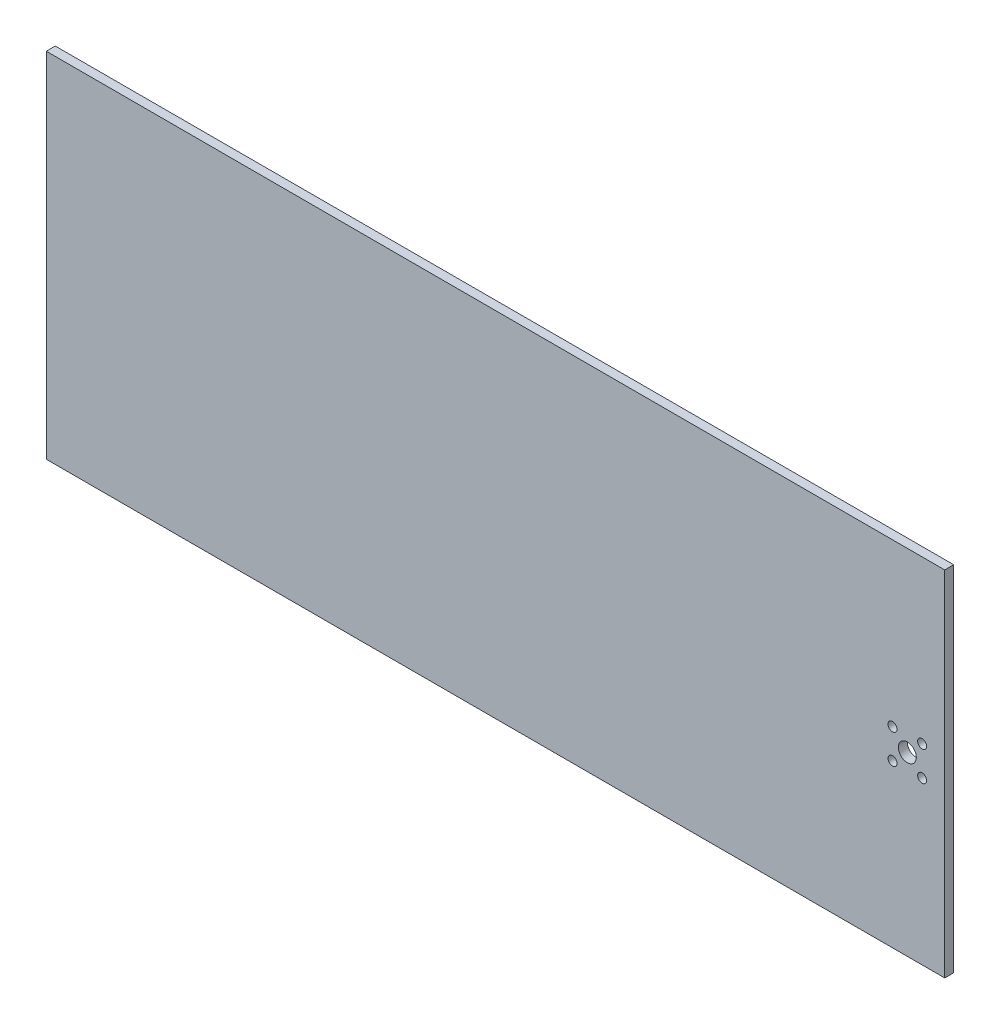
from build123d import *

# Parameters (mm, degrees)
SKETCH_1_W          = 300
SKETCH_1_H          = 118
EXTRUDE_1_DEPTH     = 3
SKETCH_2_R          = 1.5
SKETCH_2_R_2        = 3
CUT_EXTRUDE_1_DEPTH = 3


with BuildPart() as part:
    # 草图1 → 凸台-拉伸1 (new body)
    with BuildSketch(Plane.XY):
        Rectangle(SKETCH_1_W, SKETCH_1_H)
    extrude(amount=EXTRUDE_1_DEPTH)

    # 草图2 → 切除-拉伸1 (cut)
    with BuildSketch(Plane(origin=(0, 0, 0), x_dir=(-1, 0, 0), z_dir=(0, 0, -1))):
        with Locations((-142.449747468, 4.949747468)):
            Circle(SKETCH_2_R)
        with Locations((-132.550252532, 4.949747468)):
            Circle(SKETCH_2_R)
        with Locations((-137.5, 0)):
            Circle(SKETCH_2_R_2)
        with Locations((-142.449747468, -4.949747468)):
            Circle(SKETCH_2_R)
        with Locations((-132.550252532, -4.949747468)):
            Circle(SKETCH_2_R)
    extrude(amount=-CUT_EXTRUDE_1_DEPTH, mode=Mode.SUBTRACT)


solid = part.part
